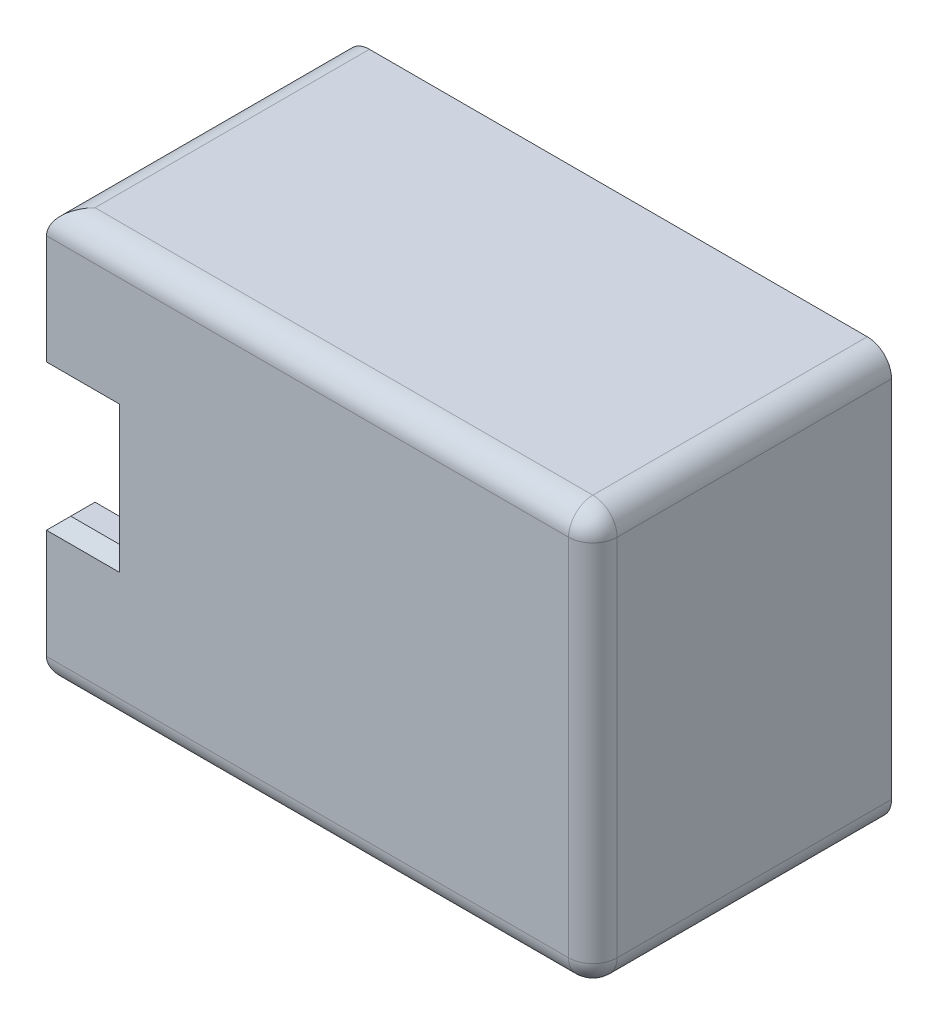
from build123d import *

# Parameters (mm, degrees)
BOSS_EXTRUDE1_DEPTH = 27.432
BOSS_EXTRUDE2_DEPTH = 5.08
SKETCH4_R           = 1.524
CUT_EXTRUDE1_DEPTH  = 2.286
SKETCH4_4_R         = 1.524
CUT_EXTRUDE2_DEPTH  = 43.216947178
BOSS_EXTRUDE3_DEPTH = 3.81
FILLET1_R           = 2.54
CHAMFER3_SIZE       = 1.27
CHAMFER4_SIZE       = 0.254


with BuildPart() as part:
    # Sketch1 → Boss-Extrude1 (new body)
    with BuildSketch(Plane.XY):
        Polygon((-28.575, 21.59), (-28.575, 17.78), (24.765, 17.78), (24.765, -17.78), (-28.575, -17.78), (-28.575, -21.59), (28.575, -21.59), (28.575, 21.59), align=None)
    extrude(amount=BOSS_EXTRUDE1_DEPTH)

    # Sketch1<3> → Boss-Extrude2 (add)
    with BuildSketch(Plane.XY):
        Polygon((24.765, 17.78), (-28.575, 17.78), (-28.575, 10.16), (17.145, 10.16), (17.145, -10.16), (-28.575, -10.16), (-28.575, -17.78), (24.765, -17.78), align=None)
    extrude(amount=BOSS_EXTRUDE2_DEPTH)

    # Sketch4 → Cut-Extrude1 (cut)
    # profile 1 of 4: a face of its own
    with BuildSketch(Plane.XY.offset(5.08)):
        Polygon((-20.655877438, 17.78), (-23.794122562, 17.78), (-25.363245123, 15.0622), (-23.794122562, 12.3444), (-20.655877438, 12.3444), (-19.086754877, 15.0622), align=None)
        with Locations((-22.225, 15.0622)):
            Circle(SKETCH4_R, mode=Mode.SUBTRACT)
    # profile 2 of 4: a face of its own
    with BuildSketch(Plane.XY.offset(5.08)):
        Polygon((18.714122562, 12.3444), (15.575877438, 12.3444), (14.006754877, 15.0622), (15.575877438, 17.78), (18.714122562, 17.78), (20.283245123, 15.0622), align=None)
        with Locations((17.145, 15.0622)):
            Circle(SKETCH4_R, mode=Mode.SUBTRACT)
    # profile 3 of 4: a face of its own
    with BuildSketch(Plane.XY.offset(5.08)):
        Polygon((20.283245123, -15.0622), (18.714122562, -12.3444), (15.575877438, -12.3444), (14.006754877, -15.0622), (15.575877438, -17.78), (18.714122562, -17.78), align=None)
        with Locations((17.145, -15.0622)):
            Circle(SKETCH4_R, mode=Mode.SUBTRACT)
    # profile 4 of 4: a face of its own
    with BuildSketch(Plane.XY.offset(5.08)):
        Polygon((-25.363245123, -15.0622), (-23.794122562, -12.3444), (-20.655877438, -12.3444), (-19.086754877, -15.0622), (-20.655877438, -17.78), (-23.794122562, -17.78), align=None)
        with Locations((-22.225, -15.0622)):
            Circle(SKETCH4_R, mode=Mode.SUBTRACT)
    extrude(amount=-CUT_EXTRUDE1_DEPTH, mode=Mode.SUBTRACT)

    # Sketch4<4> → Cut-Extrude2 (cut, through all)
    with BuildSketch(Plane.XY.offset(5.08)):
        with Locations((-22.225, 15.0622)):
            Circle(SKETCH4_4_R)
        with Locations((17.145, 15.0622)):
            Circle(SKETCH4_4_R)
        with Locations((-22.225, -15.0622)):
            Circle(SKETCH4_4_R)
        with Locations((17.145, -15.0622)):
            Circle(SKETCH4_4_R)
    extrude(amount=-CUT_EXTRUDE2_DEPTH, mode=Mode.SUBTRACT)

    # Sketch7 → Boss-Extrude3 (add)
    with BuildSketch(Plane.XY.offset(27.432)):
        Polygon((-28.575, 21.59), (28.575, 21.59), (28.575, -21.59), (-28.575, -21.59), (-28.575, -6.35), (-22.225, -6.35), (-22.225, 6.35), (-28.575, 6.35), align=None)
    extrude(amount=BOSS_EXTRUDE3_DEPTH)

    # Fillet1
    fillet1_edges = [part.edges().sort_by_distance(p)[0] for p in [
        (-28.575, 21.59, 15.621),
        (28.575, 21.59, 15.621),
        (28.575, -21.59, 15.621),
        (-28.575, -21.59, 15.621),
        (0, -21.59, 31.242),
        (28.575, 0, 31.242),
        (0, 21.59, 31.242),
    ]]
    fillet(fillet1_edges, radius=FILLET1_R)

    # Chamfer3
    chamfer3_edges = [part.edges().sort_by_distance(p)[0] for p in [
        (-28.575, 12.065, 27.432),
        (-28.575, 17.78, 16.256),
        (-28.575, 6.35, 29.337),
        (-28.575, -12.065, 27.432),
        (-28.575, -6.35, 29.337),
        (-25.4, 6.35, 31.242),
        (-22.225, 0, 31.242),
        (-25.4, -6.35, 31.242),
        (-28.575, -17.78, 16.256),
        (-28.575, -13.97, 5.08),
        (-28.575, 13.97, 5.08),
    ]]
    chamfer(chamfer3_edges, length=CHAMFER3_SIZE - 0.0001)  # a hair under: the kernel refuses the full size

    # Chamfer4
    chamfer4_edges = [part.edges().sort_by_distance(p)[0] for p in [
        (15.621, 15.0622, 0),
        (-23.749, -15.0622, 0),
        (15.621, -15.0622, 0),
        (-23.749, 15.0622, 0),
    ]]
    chamfer(chamfer4_edges, length=CHAMFER4_SIZE)


solid = part.part
